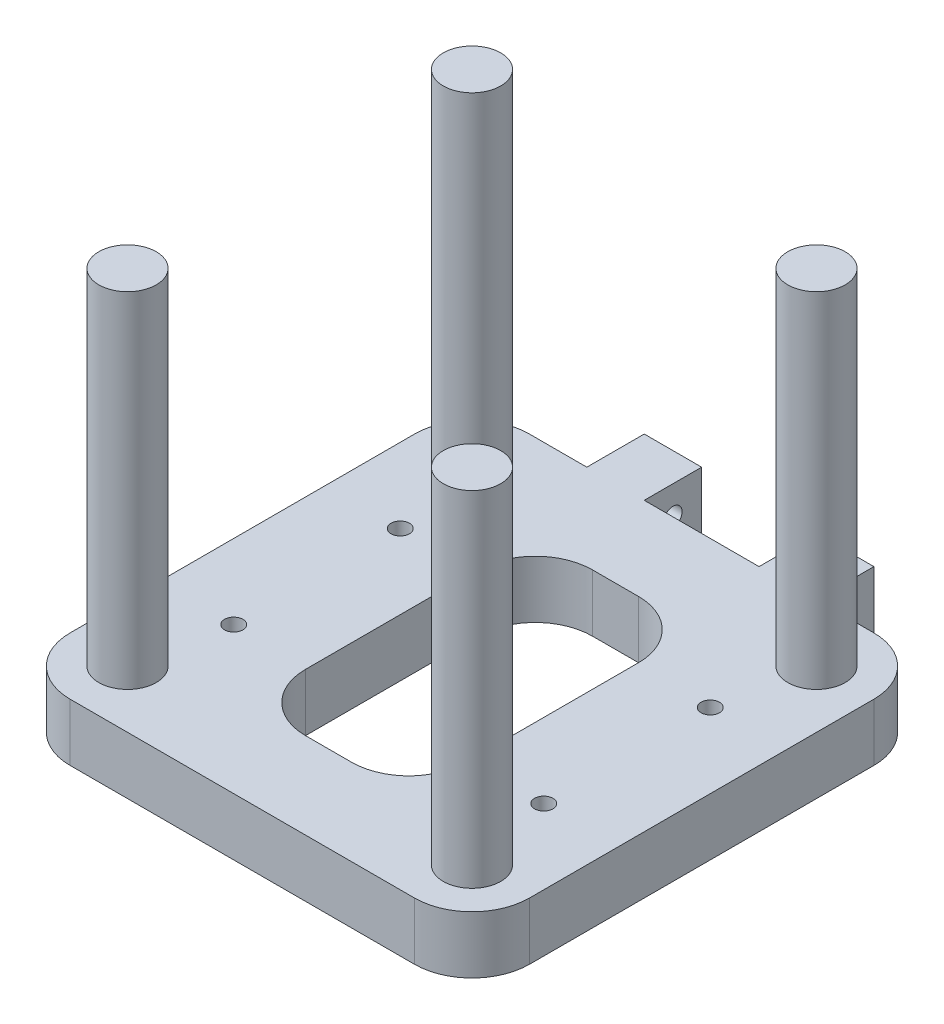
from build123d import *

# Parameters (mm, degrees)
SKETCH_1_W               = 80
SKETCH_1_H               = 80
EXTRUDE_1_DEPTH          = 10
FILLET_1_R               = 10
CUT_EXTRUDE_2_DEPTH      = 58.445626465
SKETCH_4_R               = 5
EXTRUDE_2_DEPTH          = 60
SKETCH_5_R               = 1.6
CUT_EXTRUDE_3_DEPTH      = 91
SKETCH_6_W               = 10
SKETCH_6_H               = 10
EXTRUDE_3_DEPTH          = 10
CUT_EXTRUDE_4_DEPTH      = 95.868329805
CUT_EXTRUDE_4_DEPTH_BACK = 95.868329805
SKETCH_7_R               = 1.6


with BuildPart() as part:
    # ｽｹｯﾁ1 → ﾎﾞｽ - 押し出し1 (new body)
    with BuildSketch(Plane(origin=(0, 0, 0), x_dir=(1, 0, 0), z_dir=(0, 1, 0))):
        Rectangle(SKETCH_1_W, SKETCH_1_H)
    extrude(amount=EXTRUDE_1_DEPTH)

    # ﾌｨﾚｯﾄ1
    fillet_1_edges = [part.edges().sort_by_distance(p)[0] for p in [
        (-40, 5, -40),
        (40, 5, -40),
        (40, 5, 40),
        (-40, 5, 40),
    ]]
    fillet(fillet_1_edges, radius=FILLET_1_R)

    # ｽｹｯﾁ3 → ｶｯﾄ - 押し出し2 (cut, through all)
    with BuildSketch(Plane(origin=(0, 10, 0), x_dir=(1, 0, 0), z_dir=(0, 1, 0))):
        with BuildLine():
            Line((-4, -25), (4, -25))
            ThreePointArc((4, -25), (11.071067812, -22.071067812), (14, -15))
            Line((14, -15), (14, 15))
            ThreePointArc((14, 15), (11.071067812, 22.071067812), (4, 25))
            Line((4, 25), (-4, 25))
            ThreePointArc((-4, 25), (-11.071067812, 22.071067812), (-14, 15))
            Line((-14, 15), (-14, -15))
            ThreePointArc((-14, -15), (-11.071067812, -22.071067812), (-4, -25))
        make_face()
    extrude(amount=-CUT_EXTRUDE_2_DEPTH, mode=Mode.SUBTRACT)

    # ｽｹｯﾁ4 → ﾎﾞｽ - 押し出し2 (add)
    with BuildSketch(Plane(origin=(0, 10, 0), x_dir=(1, 0, 0), z_dir=(0, 1, 0))):
        with Locations((-30, 30)):
            Circle(SKETCH_4_R)
        with Locations((30, 30)):
            Circle(SKETCH_4_R)
        with Locations((-30, -30)):
            Circle(SKETCH_4_R)
        with Locations((30, -30)):
            Circle(SKETCH_4_R)
    extrude(amount=EXTRUDE_2_DEPTH)

    # ｽｹｯﾁ5 → ｶｯﾄ - 押し出し3 (cut, through all)
    with BuildSketch(Plane.XZ):
        with Locations((27, 14.5)):
            Circle(SKETCH_5_R)
        with Locations((-27, 14.5)):
            Circle(SKETCH_5_R)
        with Locations((-27, -14.5)):
            Circle(SKETCH_5_R)
        with Locations((27, -14.5)):
            Circle(SKETCH_5_R)
    extrude(amount=-CUT_EXTRUDE_3_DEPTH, mode=Mode.SUBTRACT)

    # ｽｹｯﾁ6 → ﾎﾞｽ - 押し出し3 (add)
    with BuildSketch(Plane(origin=(0, 0, -40), x_dir=(-1, 0, 0), z_dir=(0, 0, -1))):
        with Locations((-15, 5)):
            Rectangle(SKETCH_6_W, SKETCH_6_H)
        with Locations((15, 5)):
            Rectangle(SKETCH_6_W, SKETCH_6_H)
    extrude(amount=EXTRUDE_3_DEPTH)

    # ｽｹｯﾁ7 → ｶｯﾄ - 押し出し4 (cut, two sides: drawn at the far end of the back side and taken through both)
    with BuildSketch(Plane(origin=(0, 0, 0), x_dir=(0, 0, -1), z_dir=(1, 0, 0)).offset(-CUT_EXTRUDE_4_DEPTH_BACK)):
        with Locations((45, 5)):
            Circle(SKETCH_7_R)
    extrude(amount=CUT_EXTRUDE_4_DEPTH + CUT_EXTRUDE_4_DEPTH_BACK, mode=Mode.SUBTRACT)


solid = part.part
